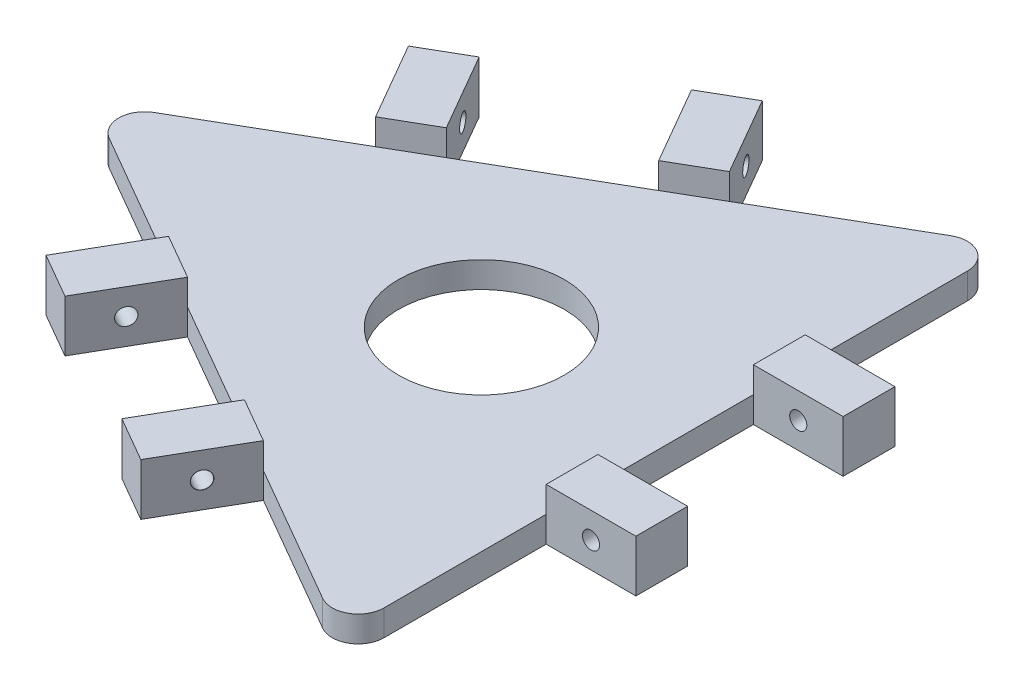
from build123d import *

# Parameters (mm, degrees)
BOSS_EXTRUDE1_DEPTH               = 5
BOSS_EXTRUDE3_DEPTH               = 10
TAP_DRILL_FOR_M4_TAP1_D           = 3.3
TAP_DRILL_FOR_M4_TAP1_CSINK_D     = 3.35
TAP_DRILL_FOR_M4_TAP1_CSINK_ANGLE = 90
CIRPATTERN1_COUNT                 = 3
SKETCH13_R                        = 16
CUT_EXTRUDE1_DEPTH                = 94.577061893


with BuildPart() as part:
    # Sketch2 → Boss-Extrude1 (new body)
    with BuildSketch(Plane(origin=(0, 0, 0), x_dir=(0, 0, -1), z_dir=(0, 1, 0))):
        with BuildLine():
            Line((4.330127019, 67.5), (19.975952642, 40.400635095))
            Line((19.975952642, 40.400635095), (24.975952642, 31.740381057))
            Line((24.975952642, 31.740381057), (39.975952642, 5.759618943))
            Line((39.975952642, 5.759618943), (44.975952642, -2.900635095))
            Line((44.975952642, -2.900635095), (60.621778265, -30))
            ThreePointArc((60.621778265, -30), (60.621778265, -35), (56.291651246, -37.5))
            Line((56.291651246, -37.5), (25, -37.5))
            Line((25, -37.5), (15, -37.5))
            Line((15, -37.5), (-15, -37.5))
            Line((-15, -37.5), (-25, -37.5))
            Line((-25, -37.5), (-56.291651246, -37.5))
            ThreePointArc((-56.291651246, -37.5), (-60.621778265, -35), (-60.621778265, -30))
            Line((-60.621778265, -30), (-44.975952642, -2.900635095))
            Line((-44.975952642, -2.900635095), (-39.975952642, 5.759618943))
            Line((-39.975952642, 5.759618943), (-24.975952642, 31.740381057))
            Line((-24.975952642, 31.740381057), (-19.975952642, 40.400635095))
            Line((-19.975952642, 40.400635095), (-4.330127019, 67.5))
            ThreePointArc((-4.330127019, 67.5), (0, 70), (4.330127019, 67.5))
        make_face()
    extrude(amount=BOSS_EXTRUDE1_DEPTH)

    # Sketch2<7> → Boss-Extrude3 (add)
    with BuildSketch(Plane(origin=(0, 0, 0), x_dir=(0, 0, -1), z_dir=(0, 1, 0))):
        Polygon((34.975952642, 49.060889132), (19.975952642, 40.400635095), (24.975952642, 31.740381057), (39.975952642, 40.400635095), align=None)
        Polygon((39.975952642, 5.759618943), (44.975952642, -2.900635095), (59.975952642, 5.759618943), (54.975952642, 14.419872981), align=None)
    boss_extrude3 = extrude(amount=BOSS_EXTRUDE3_DEPTH)

    # Tap Drill for M4 Tap1 (through all)
    with Locations(Plane(origin=(-21.650635095, 0, 12.5), x_dir=(0.49999999999999517, 0, 0.8660254037844415), z_dir=(-0.8660254037844414, 0, 0.4999999999999951))):
        with Locations((-46.160254038, 5)):
            tap_drill_for_m4_tap1 = CounterSinkHole(TAP_DRILL_FOR_M4_TAP1_D / 2, TAP_DRILL_FOR_M4_TAP1_CSINK_D / 2, counter_sink_angle=TAP_DRILL_FOR_M4_TAP1_CSINK_ANGLE)

    # CirPattern1: Boss-Extrude3, Tap Drill for M4 Tap1 ×3 about axis
    cirpattern1_axis = Axis((0, 5, 0), (0, 1, 0))
    add([boss_extrude3.rotate(cirpattern1_axis, i * 360 / CIRPATTERN1_COUNT) for i in range(1, CIRPATTERN1_COUNT)])
    add([tap_drill_for_m4_tap1.rotate(cirpattern1_axis, i * 360 / CIRPATTERN1_COUNT) for i in range(1, CIRPATTERN1_COUNT)], mode=Mode.SUBTRACT)

    # Sketch13 → Cut-Extrude1 (cut, through all)
    with BuildSketch(Plane.XZ):
        Circle(SKETCH13_R)
    extrude(amount=-CUT_EXTRUDE1_DEPTH, mode=Mode.SUBTRACT)


solid = part.part
